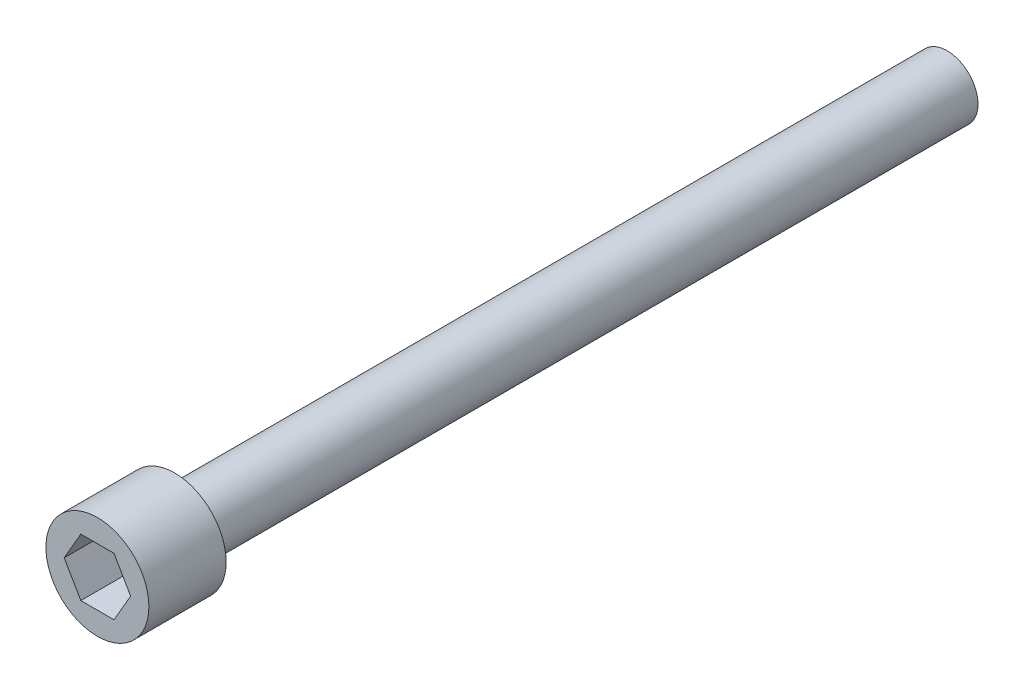
from build123d import *

# Parameters (mm, degrees)
SKETCH1_R           = 1.2
BOSS_EXTRUDE1_DEPTH = 30
SKETCH2_R           = 2
BOSS_EXTRUDE2_DEPTH = 3
CUT_EXTRUDE1_DEPTH  = 2


with BuildPart() as part:
    # Sketch1 → Boss-Extrude1 (new body)
    with BuildSketch(Plane.XY):
        with Locations((-15, 15)):
            Circle(SKETCH1_R)
    extrude(amount=-BOSS_EXTRUDE1_DEPTH)

    # Sketch2 → Boss-Extrude2 (add)
    with BuildSketch(Plane.XY):
        with Locations((-15, 15)):
            Circle(SKETCH2_R)
    extrude(amount=BOSS_EXTRUDE2_DEPTH)

    # Sketch3 → Cut-Extrude1 (cut)
    with BuildSketch(Plane.XY.offset(3)):
        Polygon((-13.709947687, 15), (-14.354973843, 16.117218076), (-15.645026157, 16.117218076), (-16.290052313, 15), (-15.645026157, 13.882781924), (-14.354973843, 13.882781924), align=None)
    extrude(amount=-CUT_EXTRUDE1_DEPTH, mode=Mode.SUBTRACT)


solid = part.part
